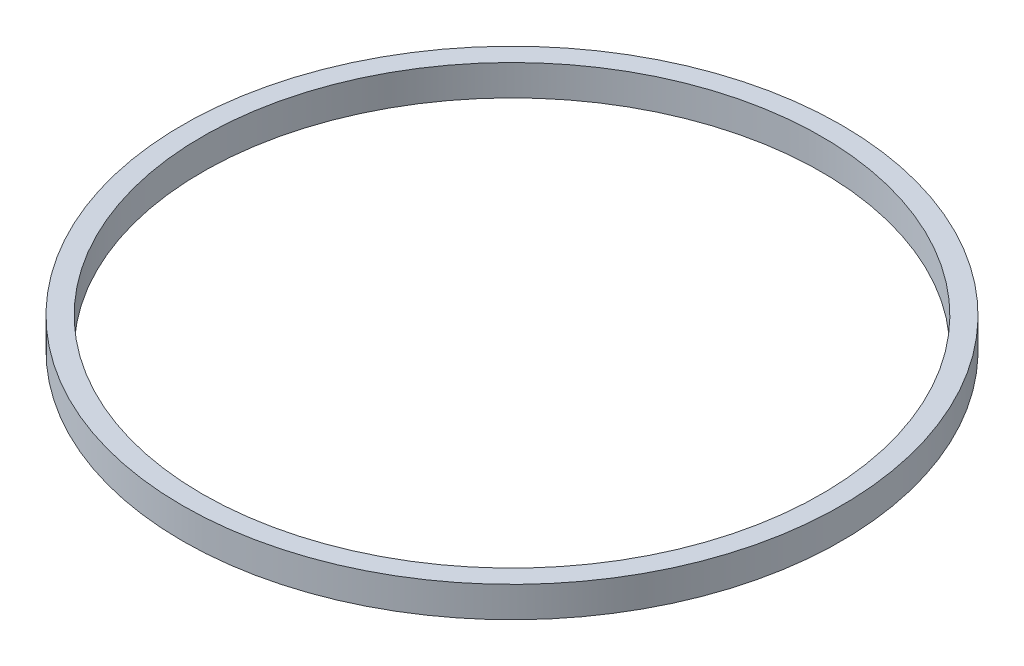
from build123d import *

# Parameters (mm, degrees)
SKETCH1_R           = 21.5
SKETCH1_R_2         = 20.2
BOSS_EXTRUDE1_DEPTH = 2


with BuildPart() as part:
    # Sketch1 → Boss-Extrude1 (new body)
    with BuildSketch(Plane(origin=(0, 0, 0), x_dir=(1, 0, 0), z_dir=(0, 1, 0))):
        Circle(SKETCH1_R)
        Circle(SKETCH1_R_2, mode=Mode.SUBTRACT)
    extrude(amount=BOSS_EXTRUDE1_DEPTH)


solid = part.part
